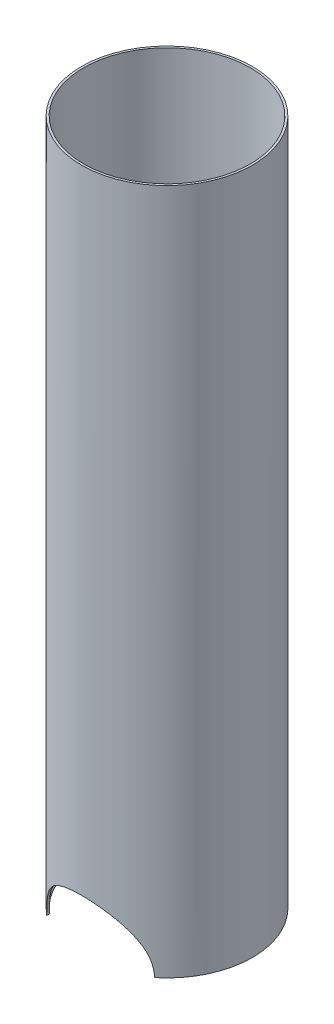
from build123d import *

# Parameters (mm, degrees)
OEM_DEPTH                        = 457.2
OEM_DEPTH_BACK                   = 152.4
SKETCH1_R                        = 63.5
SKETCH1_R_2                      = 61.9125
SKETCH3_R                        = 63.5
FLOOR_2_DEPTH                    = 1.5875
ENSR_BASEPLATE_CUTOUT_DEPTH      = 466.935982727
ENSR_BASEPLATE_CUTOUT_DEPTH_BACK = 466.935982727
TOO_LONG_DEPTH                   = 466.935982853
TOO_LONG_DEPTH_BACK              = 466.935982853
SKETCH6_W                        = 127
SKETCH6_H                        = 100


with BuildPart() as part:
    # Sketch1 → OEM (new, two sides: drawn at the far end of the back side and taken through both)
    with BuildSketch(Plane(origin=(0, 0, 0), x_dir=(1, 0, 0), z_dir=(0, 1, 0)).offset(-OEM_DEPTH_BACK)):
        Circle(SKETCH1_R)
        Circle(SKETCH1_R_2, mode=Mode.SUBTRACT)
    extrude(amount=OEM_DEPTH + OEM_DEPTH_BACK)

    # Sketch3 → floor 2 (add)
    with BuildSketch(Plane(origin=(0, -110, 0), x_dir=(1, 0, 0), z_dir=(0, 1, 0))):
        Circle(SKETCH3_R)
    extrude(amount=FLOOR_2_DEPTH)

    # Sketch5 → eNSR baseplate cutout (cut, two sides: drawn at the far end of the back side and taken through both)
    with BuildSketch(Plane.XY.offset(-ENSR_BASEPLATE_CUTOUT_DEPTH_BACK)):
        with BuildLine():
            Line((40, -1399.047742892), (40, -152.4))
            ThreePointArc((40, -152.4), (0, -112.4), (-40, -152.4))
            Line((-40, -152.4), (-40, -1399.047742892))
            Line((-40, -1399.047742892), (-40, -3892.343228676))
            Line((-40, -3892.343228676), (40, -3892.343228676))
            Line((40, -3892.343228676), (40, -1399.047742892))
        make_face()
    extrude(amount=ENSR_BASEPLATE_CUTOUT_DEPTH + ENSR_BASEPLATE_CUTOUT_DEPTH_BACK, mode=Mode.SUBTRACT)

    # Sketch6 → too long (cut, two sides: drawn at the far end of the back side and taken through both)
    with BuildSketch(Plane.XY.offset(-TOO_LONG_DEPTH_BACK)):
        with Locations((0, 407.2)):
            Rectangle(SKETCH6_W, SKETCH6_H)
    extrude(amount=TOO_LONG_DEPTH + TOO_LONG_DEPTH_BACK, mode=Mode.SUBTRACT)


solid = part.part
